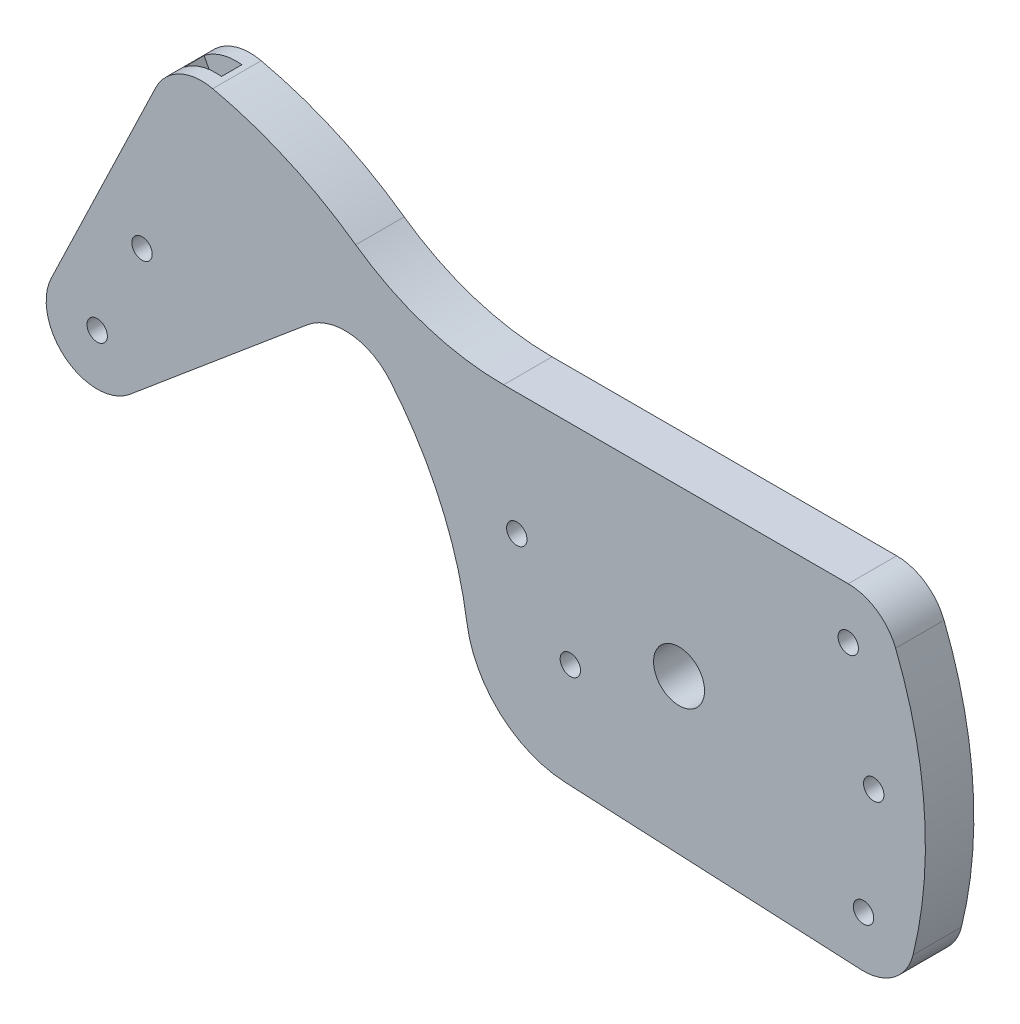
from build123d import *

# Parameters (mm, degrees)
SKETCH1_R           = 2
SKETCH1_R_2         = 5
BOSS_EXTRUDE1_DEPTH = 4.75
CUT_EXTRUDE1_DEPTH  = 2


with BuildPart() as part:
    # Sketch1 → Boss-Extrude1 (new, symmetric)
    with BuildSketch(Plane.XY):
        with BuildLine():
            Line((-22.308767332, -29.181670657), (35.698943118, -31.988315456))
            ThreePointArc((35.698943118, -31.988315456), (42.1516901, -30.02280497), (45.888257007, -24.406823948))
            ThreePointArc((45.888257007, -24.406823948), (48.128157677, 1.060560267), (42.475146865, 25.993435805))
            ThreePointArc((42.475146865, 25.993435805), (38.797626972, 30.574489653), (33.182217728, 32.3))
            Line((33.182217728, 32.3), (-34.397529085, 32.3))
            ThreePointArc((-34.397529085, 32.3), (-49.622555092, 34.67439152), (-63.401574193, 41.572056677))
            ThreePointArc((-63.401574193, 41.572056677), (-76.799263642, 49.225759558), (-91.448521696, 54.071013816))
            ThreePointArc((-91.448521696, 54.071013816), (-97.990041102, 53.309279516), (-102.639296293, 48.644931604))
            Line((-102.639296293, 48.644931604), (-123.129936653, 6.033713582))
            ThreePointArc((-123.129936653, 6.033713582), (-120.252485213, -6.197177966), (-107.689906175, -5.960444431))
            Line((-107.689906175, -5.960444431), (-72.864818345, 23.261273923))
            ThreePointArc((-72.864818345, 23.261273923), (-64.470178387, 25.908093735), (-56.662687309, 21.843771132))
            ThreePointArc((-56.662687309, 21.843771132), (-46.805355693, 6.125218695), (-41.605017691, -11.684788659))
            ThreePointArc((-41.605017691, -11.684788659), (-35.091884298, -23.890622031), (-22.308767332, -29.181670657))
        make_face()
        with Locations((36.182217728, -22)):
            Circle(SKETCH1_R, mode=Mode.SUBTRACT)
        with Locations((-21.317782272, -8.7)):
            Circle(SKETCH1_R, mode=Mode.SUBTRACT)
        Circle(SKETCH1_R_2, mode=Mode.SUBTRACT)
        with Locations((-31.817782272, 8.3)):
            Circle(SKETCH1_R, mode=Mode.SUBTRACT)
        with Locations((38.182217728, -0.1)):
            Circle(SKETCH1_R, mode=Mode.SUBTRACT)
        with Locations((33.182217728, 22.3)):
            Circle(SKETCH1_R, mode=Mode.SUBTRACT)
        with Locations((-105.317782272, 20)):
            Circle(SKETCH1_R, mode=Mode.SUBTRACT)
        with Locations((-114.117782272, 1.7)):
            Circle(SKETCH1_R, mode=Mode.SUBTRACT)
    extrude(amount=BOSS_EXTRUDE1_DEPTH, both=True)

    # Sketch2 → Cut-Extrude1 (cut, symmetric)
    with BuildSketch(Plane.XY):
        with BuildLine():
            Line((-78.227129447, 18.761760655), (-91.668909505, 44.876871439))
            Line((-91.668909505, 44.876871439), (-92.486661389, 54.245970368))
            ThreePointArc((-92.486661389, 54.245970368), (-96.402275052, 53.918435936), (-99.889427329, 52.10761343))
            Line((-99.889427329, 52.10761343), (-95.58537432, 43.745564604))
            Line((-95.58537432, 43.745564604), (-92.369017313, 6.895307763))
            Line((-92.369017313, 6.895307763), (-78.227129447, 18.761760655))
        make_face()
    extrude(amount=CUT_EXTRUDE1_DEPTH, both=True, mode=Mode.SUBTRACT)


solid = part.part
